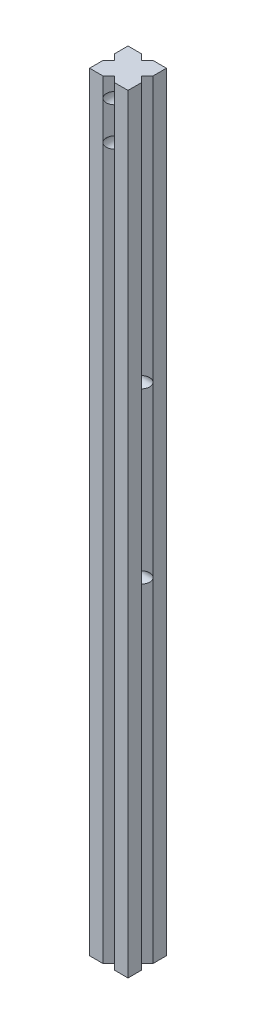
from build123d import *

# Parameters (mm, degrees)
SKIZZE1_W                       = 20
SKIZZE1_H                       = 20
AUFSATZ_LINEAR_AUSTRAGEN1_DEPTH = 400
SCHNITT_LINEAR_AUSTRAGEN1_DEPTH = 401.998753115
SKETCH1_R                       = 3
CUT_EXTRUDE1_DEPTH              = 20
SKETCH2_R                       = 3
CUT_EXTRUDE2_DEPTH              = 20


with BuildPart() as part:
    # Skizze1 → Aufsatz-Linear austragen1 (new body)
    with BuildSketch(Plane(origin=(0, 0, 0), x_dir=(1, 0, 0), z_dir=(0, 1, 0))):
        with Locations((10, 10)):
            Rectangle(SKIZZE1_W, SKIZZE1_H)
    extrude(amount=AUFSATZ_LINEAR_AUSTRAGEN1_DEPTH)

    # Skizze2 → Schnitt-Linear austragen1 (cut, through all)
    with BuildSketch(Plane(origin=(0, 400, 0), x_dir=(1, 0, 0), z_dir=(0, 1, 0))):
        Polygon((7, 20), (10, 17), (13, 20), align=None)
        Polygon((20, 13), (17, 10), (20, 7), align=None)
        Polygon((0, 7), (0, 13), (3, 10), align=None)
        Polygon((7, 0), (13, 0), (10, 3), align=None)
    extrude(amount=-SCHNITT_LINEAR_AUSTRAGEN1_DEPTH, mode=Mode.SUBTRACT)

    # Sketch1 → Cut-Extrude1 (cut)
    with BuildSketch(Plane(origin=(20, 0, 0), x_dir=(0, 0, -1), z_dir=(1, 0, 0))):
        with Locations((10, 262)):
            Circle(SKETCH1_R)
        with Locations((10, 174)):
            Circle(SKETCH1_R)
    extrude(amount=-CUT_EXTRUDE1_DEPTH, mode=Mode.SUBTRACT)

    # Sketch2 → Cut-Extrude2 (cut)
    with BuildSketch(Plane.XY):
        with Locations((10, 390)):
            Circle(SKETCH2_R)
        with Locations((10, 370)):
            Circle(SKETCH2_R)
    extrude(amount=-CUT_EXTRUDE2_DEPTH, mode=Mode.SUBTRACT)


solid = part.part
